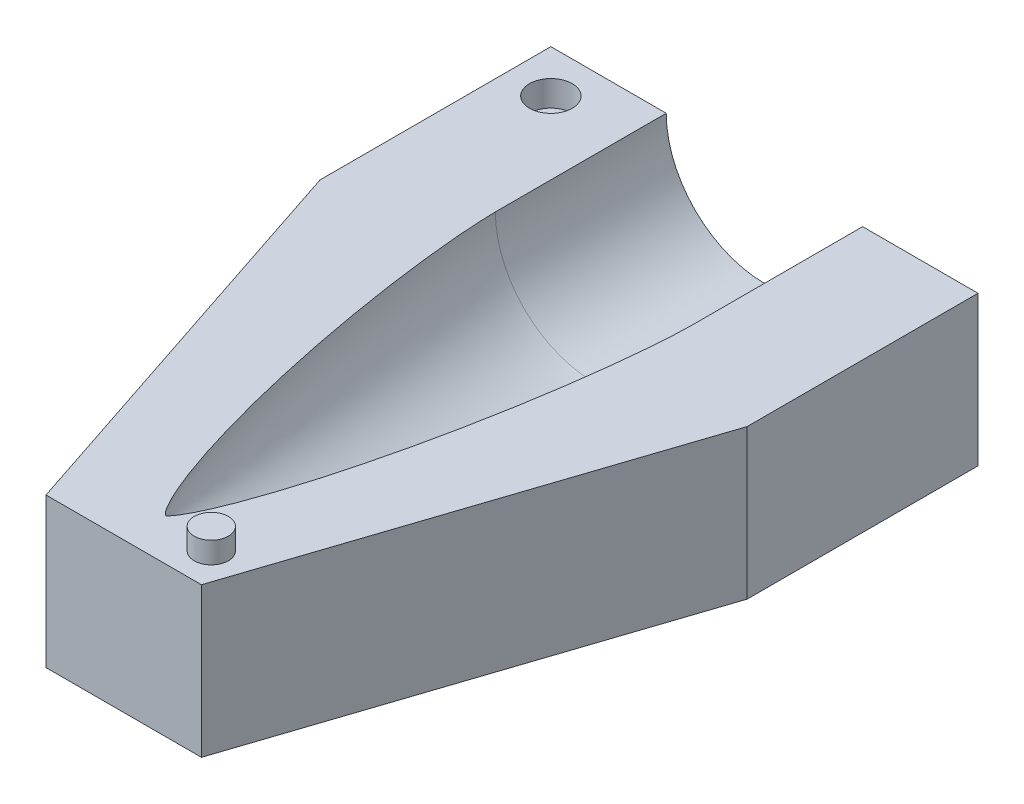
from build123d import *

# Parameters (mm, degrees)
SKETCH2_W            = 150
SKETCH2_H            = 70
BOSS_EXTRUDE1_DEPTH  = 50
INTERSECT1_OUTLINE_W = 100
INTERSECT1_OUTLINE_H = 150
INTERSECT1_DEPTH     = 35
CUT_EXTRUDE1_DEPTH   = 153.887652053
SKETCH4_R            = 4
BOSS_EXTRUDE2_DEPTH  = 5
SKETCH8_R            = 5
CUT_EXTRUDE2_DEPTH   = 6


# Read off the part's stored shape, not the designer's step: Intersect1
with BuildPart() as part:
    # Sketch2 → Boss-Extrude1 (new, symmetric)
    with BuildSketch(Plane(origin=(0, 0, 0), x_dir=(0, 0, -1), z_dir=(1, 0, 0))):
        with Locations((65.177152604, 0)):
            Rectangle(SKETCH2_W, SKETCH2_H)
    extrude(amount=BOSS_EXTRUDE1_DEPTH, both=True)

    # Sketch1 → Cut-Revolve1 (revolve, cut)
    with BuildSketch(Plane(origin=(0, 0, 0), x_dir=(0, 0, -1), z_dir=(1, 0, 0)), mode=Mode.PRIVATE) as cut_revolve1_sk:
        with BuildLine():
            Line((140.177152604, 22.991315667), (100.177152604, 22.991315667))
            add(Edge.make_bspline(
                [(0, 0), (0.003001049, 0.012379499), (0.011197692, 0.036351162), (0.030910939, 0.072587893), (0.061826137, 0.121023529), (0.108056169, 0.183557631), (0.181890949, 0.271568579), (0.306591117, 0.401983994), (0.524430354, 0.601235581), (0.901337009, 0.902060291), (1.552737658, 1.35492318), (2.678502901, 2.03469009), (4.445764918, 2.96045388), (7.403328149, 4.31706154), (11.599431889, 5.985386832), (16.823063538, 7.814259146), (22.879973582, 9.705127394), (29.12300565, 11.472646372), (35.403551613, 13.101460315), (41.714266155, 14.60858848), (48.050573205, 16.004129586), (54.409190393, 17.293961353), (60.787889899, 18.480587367), (67.185029056, 19.563313869), (73.599488728, 20.538609835), (80.030497438, 21.398160754), (86.47762614, 22.128684831), (91.82278076, 22.603702016), (96.058091382, 22.875635683), (98.677996749, 22.971409991), (99.677383084, 22.991315667), (100.177152604, 22.991315667)],
                knots=[0, 0, 0, 0, 0, 0.000489987, 0.000979974, 0.001581787, 0.002219798, 0.003488078, 0.005411983, 0.008540376, 0.013605957, 0.022087023, 0.03601085, 0.059264391, 0.090564505, 0.147620712, 0.210220905, 0.272821133, 0.335421343, 0.398021557, 0.460621765, 0.523221981, 0.585822195, 0.648422407, 0.711022626, 0.773622837, 0.836223055, 0.89882327, 0.961423485, 0.980711742, 1, 1, 1, 1, 1], degree=4))
            Line((0, 0), (140.177152604, 0))
            Line((140.177152604, 0), (140.177152604, 22.991315667))
        make_face()
    revolve(cut_revolve1_sk.sketch.rotate(Axis((0, 0, 0), (0, 0, -1)), 90), axis=Axis((0, 0, 0), (0, 0, -1)), mode=Mode.SUBTRACT)

    # Intersect1 outline → Intersect1 (cut)
    with BuildSketch(Plane(origin=(0, 0, 0), x_dir=(1, 0, 0), z_dir=(0, 1, 0))):
        with Locations((0, 65.177152604)):
            Rectangle(INTERSECT1_OUTLINE_W, INTERSECT1_OUTLINE_H)
    extrude(amount=INTERSECT1_DEPTH, mode=Mode.SUBTRACT)

    # Sketch5 → Cut-Extrude1 (cut, through all)
    with BuildSketch(Plane(origin=(0, 0, 0), x_dir=(1, 0, 0), z_dir=(0, 1, 0))):
        Polygon((50, 86.137976919), (18.194421541, -9.822847396), (0, -21.198201401), (-18.194421541, -9.822847396), (-50, 86.137976919), (-75.365394844, 84.804131947), (-88.729692443, -46.913449713), (-13.099565549, -40.658440604), (76.90354762, -33.214709966), (74.65964276, 87.590776178), align=None)
    extrude(amount=-CUT_EXTRUDE1_DEPTH, mode=Mode.SUBTRACT)

    # Sketch4 → Boss-Extrude2 (add)
    with BuildSketch(Plane(origin=(0, 0, 0), x_dir=(1, 0, 0), z_dir=(0, 1, 0))):
        with Locations(Location((12.5, -1.822847396, 0), (0, 0, 270))):
            Circle(SKETCH4_R)
    extrude(amount=BOSS_EXTRUDE2_DEPTH)

    # Sketch8 → Cut-Extrude2 (cut)
    with BuildSketch(Plane(origin=(0, 0, 0), x_dir=(1, 0, 0), z_dir=(0, 1, 0))):
        with Locations(Location((-40, 130.177152604, 0), (0, 0, 270))):
            Circle(SKETCH8_R)
    extrude(amount=-CUT_EXTRUDE2_DEPTH, mode=Mode.SUBTRACT)


solid = part.part
